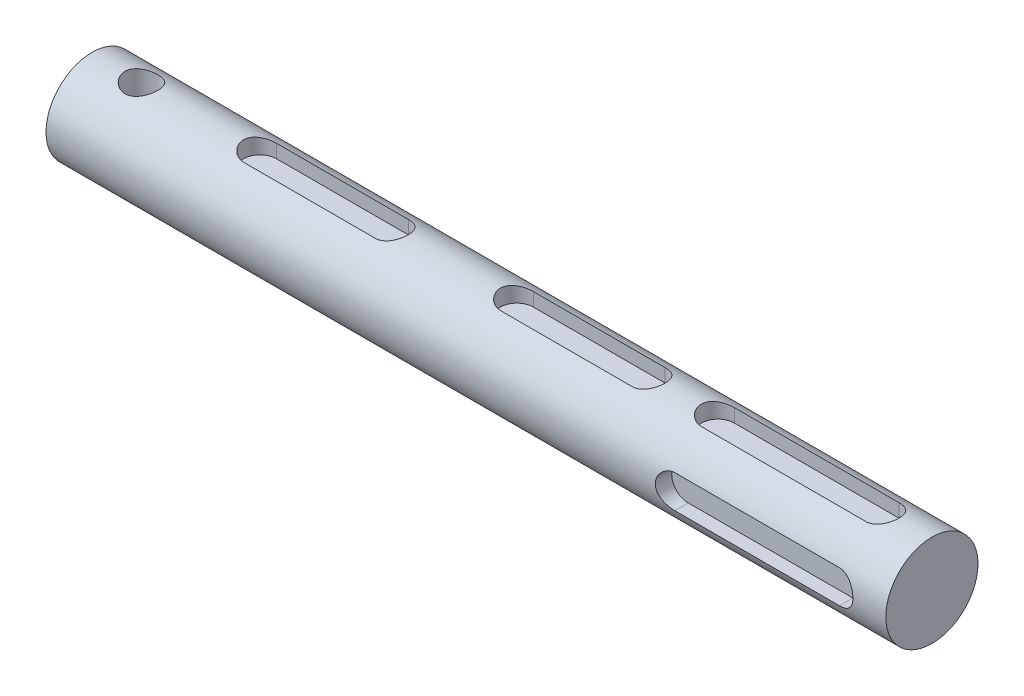
from build123d import *
from build123d.topology import SkipClean

# Parameters (mm, degrees)
SKETCH1_R               = 7
BOSS_EXTRUDE1_DEPTH     = 35
CUT_EXTRUDE1_DEPTH      = 2.5
SKETCH5_R               = 7
BOSS_EXTRUDE3_DEPTH     = 20
CUT_EXTRUDE2_DEPTH      = 56.883808056
CUT_EXTRUDE2_DEPTH_BACK = 56.883808056
SKETCH6_R               = 2.5
BOSS_EXTRUDE4_START     = 37.5
SKETCH7_R               = 7
BOSS_EXTRUDE4_DEPTH     = 37.5
CUT_EXTRUDE3_DEPTH      = 2.5
CUT_EXTRUDE4_DEPTH      = 2.5


with BuildPart() as part:
    # Sketch1 → Boss-Extrude1 (new, symmetric)
    with BuildSketch(Plane(origin=(0, 0, 0), x_dir=(0, 0, -1), z_dir=(1, 0, 0))):
        Circle(SKETCH1_R)
    extrude(amount=BOSS_EXTRUDE1_DEPTH, both=True)

    # Sketch4 → Cut-Extrude1 (cut)
    with BuildSketch(Plane(origin=(0, 7, 0), x_dir=(1, 0, 0), z_dir=(0, 1, 0))):
        with BuildLine():
            Line((-29.5, 2.5), (-9.5, 2.5))
            ThreePointArc((-9.5, 2.5), (-7, 0), (-9.5, -2.5))
            Line((-9.5, -2.5), (-29.5, -2.5))
            ThreePointArc((-29.5, -2.5), (-32, 0), (-29.5, 2.5))
        make_face()
    cut_extrude1 = extrude(amount=-CUT_EXTRUDE1_DEPTH, mode=Mode.SUBTRACT)

    # Mirror1: Cut-Extrude1 across plane
    add(cut_extrude1.mirror(Plane(origin=(0, 0, 0), x_dir=(0, 0, 1), z_dir=(1, 0, 0))), mode=Mode.SUBTRACT)

    # Sketch5 → Boss-Extrude3 (add)
    with BuildSketch(Plane.ZY.offset(35)):
        Circle(SKETCH5_R)
    extrude(amount=BOSS_EXTRUDE3_DEPTH)

    # Sketch6 → Cut-Extrude2 (cut, two sides: drawn at the far end of the back side and taken through both)
    with BuildSketch(Plane(origin=(0, 0, 0), x_dir=(1, 0, 0), z_dir=(0, 1, 0)).offset(-CUT_EXTRUDE2_DEPTH_BACK)):
        with Locations((-47.5, 0)):
            Circle(SKETCH6_R)
    extrude(amount=CUT_EXTRUDE2_DEPTH + CUT_EXTRUDE2_DEPTH_BACK, mode=Mode.SUBTRACT)

    # Sketch7 → Boss-Extrude4 (add)
    with SkipClean():  # the faces are left unmerged after this step: merging them gives an invalid solid
        with BuildSketch(Plane(origin=(35, 0, 0), x_dir=(0, 0, -1), z_dir=(1, 0, 0)).offset(BOSS_EXTRUDE4_START)):
            Circle(SKETCH7_R)
        extrude(amount=-BOSS_EXTRUDE4_DEPTH)

    # Sketch9 → Cut-Extrude3 (cut)
    with SkipClean():  # the faces are left unmerged after this step: merging them gives an invalid solid
        with BuildSketch(Plane(origin=(0, 7, 0), x_dir=(1, 0, 0), z_dir=(0, 1, 0))):
            with BuildLine():
                Line((40, 2.5), (65, 2.5))
                ThreePointArc((65, 2.5), (67.5, 0), (65, -2.5))
                Line((65, -2.5), (40, -2.5))
                ThreePointArc((40, -2.5), (37.5, 0), (40, 2.5))
            make_face()
        extrude(amount=-CUT_EXTRUDE3_DEPTH, mode=Mode.SUBTRACT)

    # Sketch10 → Cut-Extrude4 (cut)
    with SkipClean():  # the faces are left unmerged after this step: merging them gives an invalid solid
        with BuildSketch(Plane.XY.offset(7)):
            with BuildLine():
                Line((40, 2.5), (65, 2.5))
                ThreePointArc((65, 2.5), (67.5, 0), (65, -2.5))
                Line((65, -2.5), (40, -2.5))
                ThreePointArc((40, -2.5), (37.5, 0), (40, 2.5))
            make_face()
        extrude(amount=-CUT_EXTRUDE4_DEPTH, mode=Mode.SUBTRACT)


solid = part.part
